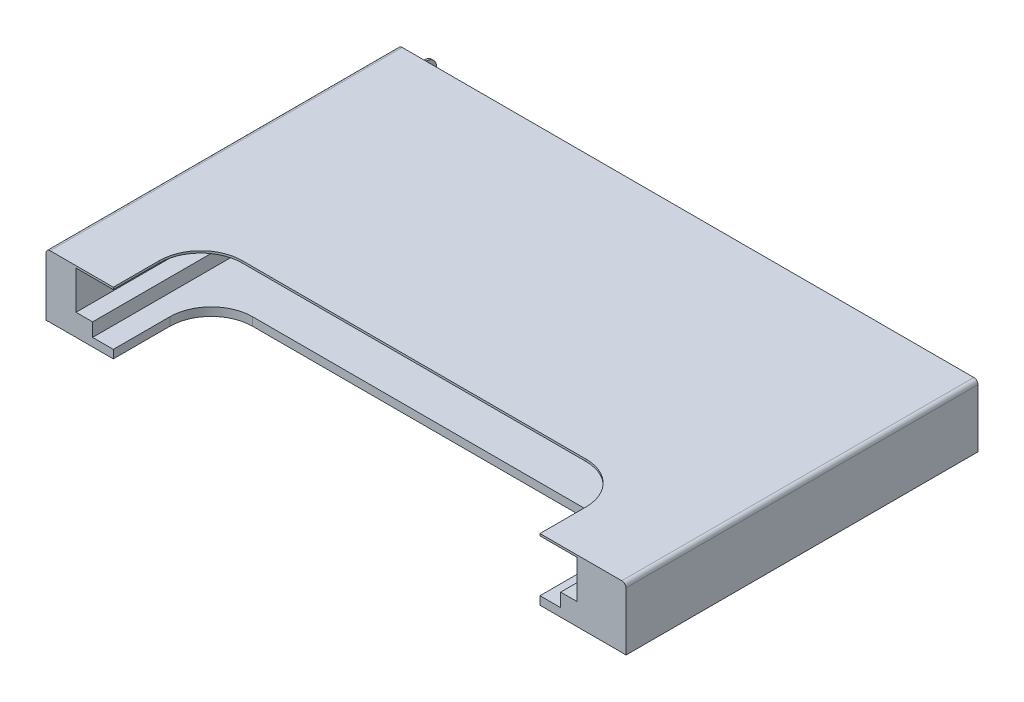
from build123d import *

# Parameters (mm, degrees)
SKETCH_5_W                           = 27.8
SKETCH_5_H                           = 2.9
EXTRUDE_4866_DEPTH                   = 29.2
CUT_EXTRUDE_5460_DEPTH               = 28
CUT_EXTRUDE_6174_DEPTH               = 0.5
SKETCH_41_W                          = 1.1
SKETCH_41_H                          = 2.9
CUT_EXTRUDE_6659_DEPTH               = 0.1
SKETCH_42_W                          = 1.1
SKETCH_42_H                          = 0.9
CUT_EXTRUDE_7111_DEPTH               = 0.1
SKETCH_13_R                          = 0.75
EXTRUDE_7658_DEPTH                   = 0.8
SKETCH_72_W                          = 1.1
SKETCH_72_H                          = 2.9
CUT_EXTRUDE_10_DEPTH                 = 0.1
SKETCH_73_W                          = 0.8
SKETCH_73_H                          = 1.1
CUT_EXTRUDE_11_DEPTH                 = 0.1
EXTRUDE_14_DEPTH                     = 0.5
EXTRUDE_14_DEPTH_BACK                = 0.5
SKETCH_74_W                          = 0.5
SKETCH_74_H                          = 1
FILLET_1_R                           = 0.3
CHAMFER_1_SIZE                       = 0.5
CHAMFER_2_SIZE                       = 0.35
CHAMFER_9439_SIZE                    = 0.3
SKETCH_30_W                          = 27.8
SKETCH_30_H                          = 27.01
SM_BASE_FLANGE_9973_DEPTH            = 0.1
SM_EDGE_FLANGE_10028_STRIP_W         = 0.6
SM_EDGE_FLANGE_10028_STRIP_H         = 0.1
SM_EDGE_FLANGE_10028_STRIP_CUT_DEPTH = 27.01
SM_EDGE_FLANGE_10028_DEPTH           = 27.01
SM_EDGE_FLANGE_10262_STRIP_W         = 0.6
SM_EDGE_FLANGE_10262_STRIP_H         = 0.1
SM_EDGE_FLANGE_10262_STRIP_CUT_DEPTH = 27.01
SM_EDGE_FLANGE_10262_DEPTH           = 27.01
CUT_EXTRUDE_10841_DEPTH              = 0.1
EXTRUDE_11151_DEPTH                  = 0.3
FILLET_11845_R                       = 0.3
PATTERN_LINEAR_1_COUNT               = 6
PATTERN_LINEAR_1_PITCH               = 2.5
FILLET_11845_OF_PATTERN_LINEAR_1_R   = 0.3
PATTERN_LINEAR_2_COUNT               = 2
PATTERN_LINEAR_2_PITCH               = 2.42
FILLET_11845_OF_PATTERN_LINEAR_2_R   = 0.3
PATTERN_LINEAR_3_COUNT               = 2
PATTERN_LINEAR_3_PITCH               = 4.12
FILLET_11845_OF_PATTERN_LINEAR_3_R   = 0.3
PATTERN_LINEAR_4_COUNT               = 2
PATTERN_LINEAR_4_PITCH               = 5.42
FILLET_11845_OF_PATTERN_LINEAR_4_R   = 0.3
CD_DEPTH                             = 0.1
GND_DEPTH                            = 0.05
GND_DEPTH_BACK                       = 0.05
SM_BASE_FLANGE_4_DEPTH               = 0.1
SM_START                             = 12.7
SM_EDGE_FLANGE_3_DEPTH               = 1
SM_EDGE_FLANGE_4_DEPTH               = 1
SM_BASE_FLANGE_5_DEPTH               = 0.1
SM_EDGE_FLANGE_5_STRIP_W             = 0.5
SM_EDGE_FLANGE_5_STRIP_H             = 0.1
SM_EDGE_FLANGE_5_STRIP_CUT_DEPTH     = 1
SM_EDGE_FLANGE_5_DEPTH               = 1
SM_EDGE_FLANGE_6_STRIP_W             = 0.5
SM_EDGE_FLANGE_6_STRIP_H             = 0.1
SM_EDGE_FLANGE_6_STRIP_CUT_DEPTH     = 1
SM_EDGE_FLANGE_6_DEPTH               = 1
SKETCH1_W                            = 36.262590985
SKETCH1_H                            = 21.311393531
CUT_EXTRUDE1_DEPTH                   = 33.800647859


# Read off the part's stored shape, not the designer's step: Ребро-кромка3, Ребро-кромка4
# Sheet-metal steps are written as plain solids
with BuildPart() as part:
    # Sketch 5 → Extrude 4866 (new body)
    with BuildSketch(Plane.XY):
        with Locations((0.45, 1.45)):
            Rectangle(SKETCH_5_W, SKETCH_5_H)
    extrude(amount=EXTRUDE_4866_DEPTH)

    # Sketch 6 → Cut-Extrude 5460 (cut)
    with BuildSketch(Plane.XY.offset(29.2)):
        Polygon((-12.1, 1.05), (-12.1, 2.9), (12.1, 2.9), (12.1, 1.05), (11.3, 1.05), (11.3, 0.4), (-11.3, 0.4), (-11.3, 1.05), align=None)
    extrude(amount=-CUT_EXTRUDE_5460_DEPTH, mode=Mode.SUBTRACT)

    # Эскиз39 → Cut-Extrude 6174 (cut)
    with BuildSketch(Plane(origin=(0, 0, 0), x_dir=(-1, 0, 0), z_dir=(0, -1, 0))):
        with BuildLine():
            Line((-10.3, -29.2), (10.3, -29.2))
            Line((10.3, -29.2), (10.3, -14.26169508))
            ThreePointArc((10.3, -14.26169508), (9.714213562, -12.847481517), (8.3, -12.26169508))
            Line((8.3, -12.26169508), (-8.3, -12.26169508))
            ThreePointArc((-8.3, -12.26169508), (-9.714213562, -12.847481517), (-10.3, -14.26169508))
            Line((-10.3, -14.26169508), (-10.3, -29.2))
        make_face()
    extrude(amount=-CUT_EXTRUDE_6174_DEPTH, mode=Mode.SUBTRACT)

    # Эскиз41 → Cut-Extrude 6659 (cut)
    with BuildSketch(Plane.XY.offset(29.2)):
        with Locations((13.2, 1.45)):
            Rectangle(SKETCH_41_W, SKETCH_41_H)
    extrude(amount=-CUT_EXTRUDE_6659_DEPTH, mode=Mode.SUBTRACT)

    # Эскиз42 → Cut-Extrude 7111 (cut)
    with BuildSketch(Plane(origin=(0, 2.9, 0), x_dir=(-1, 0, 0), z_dir=(0, 1, 0))):
        with Locations((-13.2, 28.65)):
            Rectangle(SKETCH_42_W, SKETCH_42_H)
    extrude(amount=-CUT_EXTRUDE_7111_DEPTH, mode=Mode.SUBTRACT)

    # Эскиз13 → Extrude 7658 (add)
    with BuildSketch(Plane.XZ):
        with Locations(Location((-12.1, 8.1, 0), (0, 0, 90))):
            Circle(SKETCH_13_R)
        with Locations(Location((13.1, 8.1, 0), (0, 0, 90))):
            Circle(SKETCH_13_R)
    extrude(amount=EXTRUDE_7658_DEPTH)

    # Эскиз72 → Вырез-Вытянуть10 (cut)
    with BuildSketch(Plane.ZY.offset(13.45)):
        with Locations((28.05, 1.45)):
            Rectangle(SKETCH_72_W, SKETCH_72_H)
    extrude(amount=-CUT_EXTRUDE_10_DEPTH, mode=Mode.SUBTRACT)

    # Эскиз73 → Вырез-Вытянуть11 (cut)
    with BuildSketch(Plane(origin=(0, 2.9, 0), x_dir=(-1, 0, 0), z_dir=(0, 1, 0))):
        with Locations((12.95, 28.05)):
            Rectangle(SKETCH_73_W, SKETCH_73_H)
    extrude(amount=-CUT_EXTRUDE_11_DEPTH, mode=Mode.SUBTRACT)

    # Эскиз74 → Бобышка-Вытянуть14 (add, two sides: drawn at the far end of the back side and taken through both)
    with BuildSketch(Plane.XY.offset(21.5).offset(-EXTRUDE_14_DEPTH_BACK)):
        with Locations((-13.7, 0.5)):
            Rectangle(SKETCH_74_W, SKETCH_74_H)
    extrude(amount=EXTRUDE_14_DEPTH + EXTRUDE_14_DEPTH_BACK)

    # Скругление1
    fillet_1_edges = [part.edges().sort_by_distance(p)[0] for p in [
        (-13.7, 1, 21),
        (-13.7, 1, 22),
    ]]
    fillet(fillet_1_edges, radius=FILLET_1_R)

    # Фаска_пластик1
    chamfer_1_edges = [part.edges().sort_by_distance(p)[0] for p in [
        (-11.7, 1.05, 29.2),
        (-11.3, 0.725, 29.2),
        (11.3, 0.725, 29.2),
        (11.7, 1.05, 29.2),
        (12.1, 1.975, 29.2),
        (-12.1, 1.975, 29.2),
    ]]
    chamfer(chamfer_1_edges, length=CHAMFER_1_SIZE)

    # Фаска_пластик_2
    chamfer_2_edges = [part.edges().sort_by_distance(p)[0] for p in [
        (-10.3, 0.2, 29.2),
        (-11.05, 0.4, 29.2),
        (10.3, 0.2, 29.2),
    ]]
    chamfer(chamfer_2_edges, length=CHAMFER_2_SIZE)

    # Chamfer 9439
    chamfer_9439_edges = [part.edges().sort_by_distance(p)[0] for p in [
        (-12.1, -0.8, 7.35),
        (13.1, -0.8, 7.35),
    ]]
    chamfer(chamfer_9439_edges, length=CHAMFER_9439_SIZE)

    # Эскиз14 → Extrude 11151 (add, symmetric)
    with BuildSketch(Plane(origin=(-5.63, 0, 0), x_dir=(0, 0, -1), z_dir=(1, 0, 0))):
        with BuildLine():
            Line((0, 0.326932693), (0.817714751, 0.326932693))
            ThreePointArc((0.817714751, 0.326932693), (0.87902999, 0.305929158), (0.914588493, 0.251741522))
            Line((0.914588493, 0.251741522), (0.966155464, 0.050382342))
            ThreePointArc((0.966155464, 0.050382342), (1.037272471, -0.05799293), (1.159902949, -0.1))
            Line((1.159902949, -0.1), (1.9, -0.1))
            Line((1.9, -0.1), (1.9, 0))
            Line((1.9, 0), (1.159902949, 0))
            ThreePointArc((1.159902949, 0), (1.09858771, 0.021003535), (1.063029207, 0.075191171))
            Line((1.063029207, 0.075191171), (1.011462236, 0.276550351))
            ThreePointArc((1.011462236, 0.276550351), (0.940345229, 0.384925623), (0.817714751, 0.426932693))
            Line((0.817714751, 0.426932693), (0, 0.426932693))
            Line((0, 0.426932693), (0, 0.326932693))
        make_face()
    extrude_11151 = extrude(amount=EXTRUDE_11151_DEPTH, both=True)

    # Fillet 11845
    fillet_11845_edges = [part.edges().sort_by_distance(p)[0] for p in [
        (-5.93, -0.05, -1.9),
        (-5.33, -0.05, -1.9),
    ]]
    fillet(fillet_11845_edges, radius=FILLET_11845_R - 0.0001)  # a hair under: the kernel refuses the full size

    # Линейный массив1: Extrude 11151 ×6
    with Locations(*[(i * PATTERN_LINEAR_1_PITCH, 0, 0) for i in range(1, PATTERN_LINEAR_1_COUNT)]):
        add(extrude_11151)

    # Fillet 11845 of Линейный массив1
    fillet_11845_of_pattern_linear_1_edges = [part.edges().sort_by_distance(p)[0] for p in [
        (-3.43, -0.05, -1.9),
        (-2.83, -0.05, -1.9),
        (-0.93, -0.05, -1.9),
        (-0.33, -0.05, -1.9),
        (1.57, -0.05, -1.9),
        (2.17, -0.05, -1.9),
        (4.07, -0.05, -1.9),
        (4.67, -0.05, -1.9),
        (6.57, -0.05, -1.9),
        (7.17, -0.05, -1.9),
    ]]
    fillet(fillet_11845_of_pattern_linear_1_edges, radius=FILLET_11845_OF_PATTERN_LINEAR_1_R - 0.0001)  # a hair under: the kernel refuses the full size

    # Линейный массив2: Extrude 11151 ×2
    with Locations(*[(-i * PATTERN_LINEAR_2_PITCH, 0, 0) for i in range(1, PATTERN_LINEAR_2_COUNT)]):
        add(extrude_11151)

    # Fillet 11845 of Линейный массив2
    fillet_11845_of_pattern_linear_2_edges = [part.edges().sort_by_distance(p)[0] for p in [
        (-8.35, -0.05, -1.9),
        (-7.75, -0.05, -1.9),
    ]]
    fillet(fillet_11845_of_pattern_linear_2_edges, radius=FILLET_11845_OF_PATTERN_LINEAR_2_R - 0.0001)  # a hair under: the kernel refuses the full size

    # Линейный массив3: Extrude 11151 ×2
    with Locations(*[(-i * PATTERN_LINEAR_3_PITCH, 0, 0) for i in range(1, PATTERN_LINEAR_3_COUNT)]):
        add(extrude_11151)

    # Fillet 11845 of Линейный массив3
    fillet_11845_of_pattern_linear_3_edges = [part.edges().sort_by_distance(p)[0] for p in [
        (-10.05, -0.05, -1.9),
        (-9.45, -0.05, -1.9),
    ]]
    fillet(fillet_11845_of_pattern_linear_3_edges, radius=FILLET_11845_OF_PATTERN_LINEAR_3_R - 0.0001)  # a hair under: the kernel refuses the full size

    # Линейный массив4: Extrude 11151 ×2
    with Locations(*[(-i * PATTERN_LINEAR_4_PITCH, 0, 0) for i in range(1, PATTERN_LINEAR_4_COUNT)]):
        add(extrude_11151)

    # Fillet 11845 of Линейный массив4
    fillet_11845_of_pattern_linear_4_edges = [part.edges().sort_by_distance(p)[0] for p in [
        (-11.35, -0.05, -1.9),
        (-10.75, -0.05, -1.9),
    ]]
    fillet(fillet_11845_of_pattern_linear_4_edges, radius=FILLET_11845_OF_PATTERN_LINEAR_4_R - 0.0001)  # a hair under: the kernel refuses the full size

    # Эскиз20 → Вывод_CD (add)
    with BuildSketch(Plane(origin=(-12.85, 0, 0), x_dir=(0, 0, -1), z_dir=(1, 0, 0))):
        with BuildLine():
            Line((0, 2.447952467), (0.57433497, 2.447952467))
            ThreePointArc((0.57433497, 2.447952467), (0.927888361, 2.301505858), (1.07433497, 1.947952467))
            Line((1.07433497, 1.947952467), (1.07433497, 0.5))
            ThreePointArc((1.07433497, 0.5), (1.132913614, 0.358578644), (1.27433497, 0.3))
            Line((1.27433497, 0.3), (1.7, 0.3))
            ThreePointArc((1.7, 0.3), (1.841421356, 0.241421356), (1.9, 0.1))
            Line((1.9, 0.1), (1.9, -0.1))
            Line((1.9, -0.1), (1.07433497, -0.1))
            ThreePointArc((1.07433497, -0.1), (0.72078158, 0.046446609), (0.57433497, 0.4))
            Line((0.57433497, 0.4), (0.57433497, 1.747952467))
            ThreePointArc((0.57433497, 1.747952467), (0.515756326, 1.889373823), (0.37433497, 1.947952467))
            Line((0.37433497, 1.947952467), (0, 1.947952467))
            Line((0, 1.947952467), (0, 2.447952467))
        make_face()
    extrude(amount=CD_DEPTH)



with BuildPart() as body_2:
    # Эскиз30 → Sm Base Flange 9973 (new body)
    with BuildSketch(Plane(origin=(0, 2.9, 0), x_dir=(1, 0, 0), z_dir=(0, 1, 0))):
        with Locations((0.45, -13.495)):
            Rectangle(SKETCH_30_W, SKETCH_30_H)
    extrude(amount=SM_BASE_FLANGE_9973_DEPTH)

    # Sm Edge Flange 10028 strip (across the edge) → Sm Edge Flange 10028 strip cut (cut)
    with BuildSketch(Plane(origin=(-13.45, 2.9, 27), x_dir=(1, 0, 0), z_dir=(0, 0, -1))):
        with Locations((-0.2, -0.05)):
            Rectangle(SM_EDGE_FLANGE_10028_STRIP_W, SM_EDGE_FLANGE_10028_STRIP_H)
    extrude(amount=SM_EDGE_FLANGE_10028_STRIP_CUT_DEPTH, mode=Mode.SUBTRACT)

    # Sm Edge Flange 10028 section (across the edge) → Sm Edge Flange 10028 (add)
    with BuildSketch(Plane(origin=(-13.45, 2.9, 27), x_dir=(1, 0, 0), z_dir=(0, 0, -1))):
        with BuildLine():
            Line((-0.1, 0.1), (-0.1, 2.91))
            Line((-0.1, 2.91), (0, 2.91))
            Line((0, 2.91), (0, 0.1))
            ThreePointArc((0, 0.1), (0.029289322, 0.029289322), (0.1, 0))
            Line((0.1, 0), (0.1, -0.1))
            ThreePointArc((0.1, -0.1), (-0.041421356, -0.041421356), (-0.1, 0.1))
        make_face()
    extrude(amount=SM_EDGE_FLANGE_10028_DEPTH)

    # Sm Edge Flange 10262 strip (across the edge) → Sm Edge Flange 10262 strip cut (cut)
    with BuildSketch(Plane(origin=(14.35, 2.9, -0.01), x_dir=(-1, 0, 0), z_dir=(0, 0, 1))):
        with Locations((-0.2, -0.05)):
            Rectangle(SM_EDGE_FLANGE_10262_STRIP_W, SM_EDGE_FLANGE_10262_STRIP_H)
    extrude(amount=SM_EDGE_FLANGE_10262_STRIP_CUT_DEPTH, mode=Mode.SUBTRACT)

    # Sm Edge Flange 10262 section (across the edge) → Sm Edge Flange 10262 (add)
    with BuildSketch(Plane(origin=(14.35, 2.9, -0.01), x_dir=(-1, 0, 0), z_dir=(0, 0, 1))):
        with BuildLine():
            Line((-0.1, 0.1), (-0.1, 2.91))
            Line((-0.1, 2.91), (0, 2.91))
            Line((0, 2.91), (0, 0.1))
            ThreePointArc((0, 0.1), (0.029289322, 0.029289322), (0.1, 0))
            Line((0.1, 0), (0.1, -0.1))
            ThreePointArc((0.1, -0.1), (-0.041421356, -0.041421356), (-0.1, 0.1))
        make_face()
    extrude(amount=SM_EDGE_FLANGE_10262_DEPTH)

    # Эскиз8 → Cut-Extrude 10841 (cut)
    with BuildSketch(Plane(origin=(0, 3, 0), x_dir=(1, 0, 0), z_dir=(0, 1, 0))):
        with BuildLine():
            Line((-9.3, -25.76630709), (9.3, -25.76630709))
            ThreePointArc((9.3, -25.76630709), (10.007106781, -25.473413871), (10.3, -24.76630709))
            Line((10.3, -24.76630709), (10.3, -14.76630709))
            ThreePointArc((10.3, -14.76630709), (9.714213562, -13.352093528), (8.3, -12.76630709))
            Line((8.3, -12.76630709), (-8.3, -12.76630709))
            ThreePointArc((-8.3, -12.76630709), (-9.714213562, -13.352093528), (-10.3, -14.76630709))
            Line((-10.3, -14.76630709), (-10.3, -24.76630709))
            ThreePointArc((-10.3, -24.76630709), (-10.007106781, -25.473413871), (-9.3, -25.76630709))
        make_face()
    extrude(amount=-CUT_EXTRUDE_10841_DEPTH, mode=Mode.SUBTRACT)


with BuildPart() as part_1:
    add(part.part)

    add(body_2.part)  # Вывод_GND merges body 2
    # Эскиз71 → Вывод_GND (add, two sides: drawn at the far end of the back side and taken through both)
    with BuildSketch(Plane.XY.offset(21.5).offset(-GND_DEPTH_BACK)):
        with BuildLine():
            Line((-13.55, -0.1), (-14.399652774, -0.1))
            Line((-14.399652774, -0.1), (-14.399652774, 0))
            ThreePointArc((-14.399652774, 0), (-14.370363452, 0.070710678), (-14.299652774, 0.1))
            Line((-14.299652774, 0.1), (-14.15, 0.1))
            ThreePointArc((-14.15, 0.1), (-14.079289322, 0.129289322), (-14.05, 0.2))
            Line((-14.05, 0.2), (-14.05, 1))
            ThreePointArc((-14.05, 1), (-14.020710678, 1.070710678), (-13.95, 1.1))
            Line((-13.95, 1.1), (-13.55, 1.1))
            Line((-13.55, 1.1), (-13.55, -0.1))
        make_face()
    extrude(amount=GND_DEPTH + GND_DEPTH_BACK)


with BuildPart() as body_2_2:
    # Эскиз28 → Базовая кромка4 (new body)
    with BuildSketch(Plane.XY.offset(29.2)):
        with BuildLine():
            Line((13.7, 2.8), (12.7, 2.8))
            Line((12.7, 2.8), (12.7, 0.437580966))
            Line((12.7, 0.437580966), (12.75, 0.437580966))
            ThreePointArc((12.75, 0.437580966), (12.820710678, 0.408291644), (12.85, 0.337580966))
            Line((12.85, 0.337580966), (12.85, -0.8))
            Line((12.85, -0.8), (13.55, -0.8))
            Line((13.55, -0.8), (13.55, 0.337580966))
            ThreePointArc((13.55, 0.337580966), (13.579289322, 0.408291644), (13.65, 0.437580966))
            Line((13.65, 0.437580966), (13.7, 0.437580966))
            Line((13.7, 0.437580966), (13.7, 2.8))
        make_face()
    extrude(amount=-SM_BASE_FLANGE_4_DEPTH)

    # Ребро-кромка3 outline → Ребро-кромка3 (add)
    with BuildSketch(Plane.YZ.offset(SM_START)):
        with BuildLine():
            Line((2.9, 28.5), (2.9, 29.1))
            ThreePointArc((2.9, 29.1), (2.870710678, 29.170710678), (2.8, 29.2))
            Line((2.8, 29.2), (2.8, 28.5))
            Line((2.8, 28.5), (2.9, 28.5))
        make_face()
    extrude(amount=SM_EDGE_FLANGE_3_DEPTH)

    # Ребро-кромка4 outline → Ребро-кромка4 (add)
    with BuildSketch(Plane.YZ.offset(SM_START)):
        with BuildLine():
            ThreePointArc((2.8, 28.4), (2.870710678, 28.429289322), (2.9, 28.5))
            Line((2.9, 28.5), (2.7, 28.5))
            Line((2.7, 28.5), (2.7, 28.4))
            Line((2.7, 28.4), (2.8, 28.4))
        make_face()
    extrude(amount=SM_EDGE_FLANGE_4_DEPTH)


with BuildPart() as body_3:
    # Эскиз59 → Базовая кромка5 (new body)
    with BuildSketch(Plane.ZY.offset(13.45)):
        with BuildLine():
            Line((28.55, 2.8), (27.55, 2.8))
            Line((27.55, 2.8), (27.55, 0.555707004))
            Line((27.55, 0.555707004), (27.6, 0.555707004))
            ThreePointArc((27.6, 0.555707004), (27.670710678, 0.526417682), (27.7, 0.455707004))
            Line((27.7, 0.455707004), (27.7, -0.681873961))
            Line((27.7, -0.681873961), (28.4, -0.681873961))
            Line((28.4, -0.681873961), (28.4, 0.455707004))
            ThreePointArc((28.4, 0.455707004), (28.429289322, 0.526417682), (28.5, 0.555707004))
            Line((28.5, 0.555707004), (28.55, 0.555707004))
            Line((28.55, 0.555707004), (28.55, 2.8))
        make_face()
    extrude(amount=-SM_BASE_FLANGE_5_DEPTH)

    # Ребро-кромка5 strip (across the edge) → Ребро-кромка5 strip cut (cut)
    with BuildSketch(Plane(origin=(-13.35, 2.8, 27.55), x_dir=(0, -1, 0), z_dir=(0, 0, 1))):
        with Locations((-0.2, -0.05)):
            Rectangle(SM_EDGE_FLANGE_5_STRIP_W, SM_EDGE_FLANGE_5_STRIP_H)
    extrude(amount=SM_EDGE_FLANGE_5_STRIP_CUT_DEPTH, mode=Mode.SUBTRACT)

    # Ребро-кромка5 section (across the edge) → Ребро-кромка5 (add)
    with BuildSketch(Plane(origin=(-13.35, 2.8, 27.55), x_dir=(0, -1, 0), z_dir=(0, 0, 1))):
        with BuildLine():
            Line((-0.1, 0.05), (-0.1, 0.7))
            Line((-0.1, 0.7), (0, 0.7))
            Line((0, 0.7), (0, 0.05))
            ThreePointArc((0, 0.05), (0.014644661, 0.014644661), (0.05, 0))
            Line((0.05, 0), (0.05, -0.1))
            ThreePointArc((0.05, -0.1), (-0.056066017, -0.056066017), (-0.1, 0.05))
        make_face()
    extrude(amount=SM_EDGE_FLANGE_5_DEPTH)

    # Ребро-кромка6 strip (across the edge) → Ребро-кромка6 strip cut (cut)
    with BuildSketch(Plane(origin=(-12.65, 2.8, 27.55), x_dir=(-1, 0, 0), z_dir=(0, 0, 1))):
        with Locations((-0.2, -0.05)):
            Rectangle(SM_EDGE_FLANGE_6_STRIP_W, SM_EDGE_FLANGE_6_STRIP_H)
    extrude(amount=SM_EDGE_FLANGE_6_STRIP_CUT_DEPTH, mode=Mode.SUBTRACT)

    # Ребро-кромка6 section (across the edge) → Ребро-кромка6 (add)
    with BuildSketch(Plane(origin=(-12.65, 2.8, 27.55), x_dir=(-1, 0, 0), z_dir=(0, 0, 1))):
        with BuildLine():
            Line((-0.1, 0.05), (-0.1, 0.2))
            Line((-0.1, 0.2), (0, 0.2))
            Line((0, 0.2), (0, 0.05))
            ThreePointArc((0, 0.05), (0.014644661, 0.014644661), (0.05, 0))
            Line((0.05, 0), (0.05, -0.1))
            ThreePointArc((0.05, -0.1), (-0.056066017, -0.056066017), (-0.1, 0.05))
        make_face()
    extrude(amount=SM_EDGE_FLANGE_6_DEPTH)


with BuildPart() as cut_extrude1_tool:
    # Sketch1 → Cut-Extrude1 (new, through all)
    with BuildSketch(Plane(origin=(0, 3, 0), x_dir=(-1, 0, 0), z_dir=(0, 1, 0))):
        with Locations((-1.013134584, 27.645696766)):
            Rectangle(SKETCH1_W, SKETCH1_H)
    extrude(amount=-CUT_EXTRUDE1_DEPTH)


with BuildPart() as part_2:
    add(part_1.part)

    # Cut-Extrude1: cut by cut_extrude1_tool
    add(cut_extrude1_tool.part, mode=Mode.SUBTRACT)


with BuildPart() as body_2_2_1:
    add(body_2_2.part)

    # Cut-Extrude1: cut by cut_extrude1_tool
    add(cut_extrude1_tool.part, mode=Mode.SUBTRACT)


with BuildPart() as body_3_1:
    add(body_3.part)

    # Cut-Extrude1: cut by cut_extrude1_tool
    add(cut_extrude1_tool.part, mode=Mode.SUBTRACT)


solid = part_2.part
